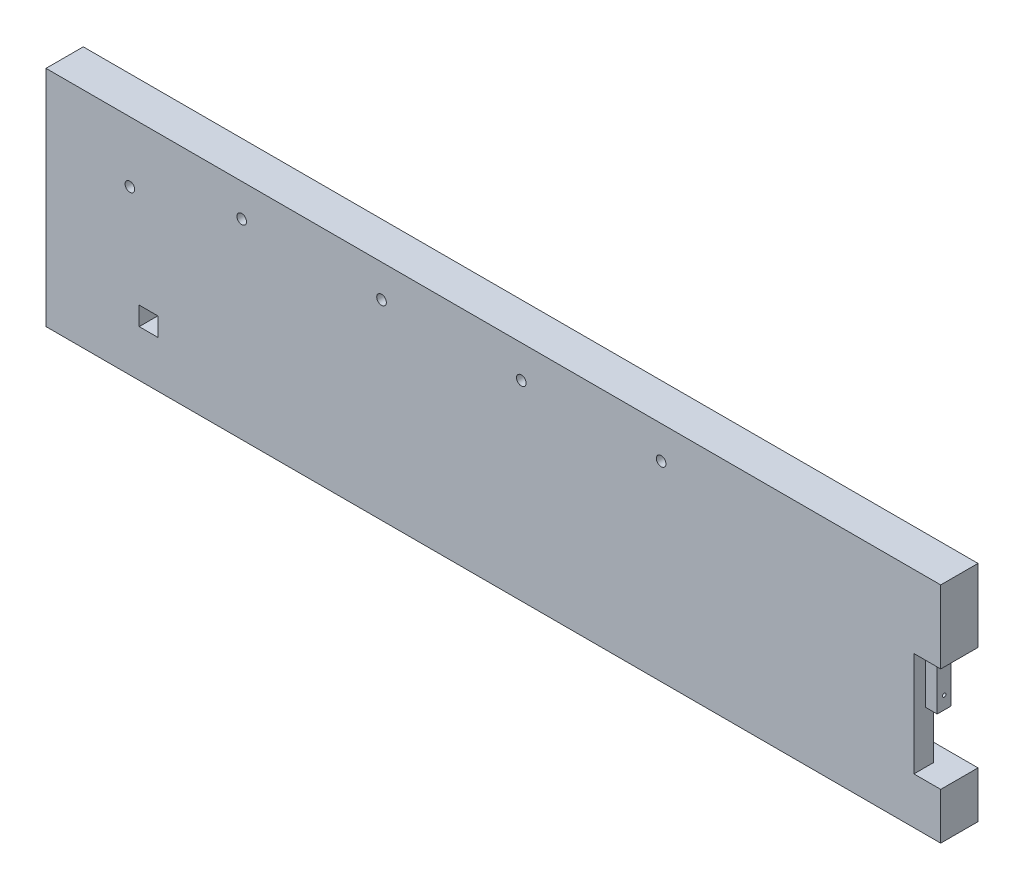
from build123d import *

# Parameters (mm, degrees)
SKETCH1_W           = 2438.4
SKETCH1_H           = 609.6
SKETCH1_R           = 13.119830451
SKETCH1_W_2         = 50.8
SKETCH1_H_2         = 50.8
BOSS_EXTRUDE1_DEPTH = 101.6
SKETCH2_W           = 127
SKETCH2_H           = 63.5
CUT_EXTRUDE1_DEPTH  = 50.8
SKETCH3_R           = 4.7625
CUT_EXTRUDE2_DEPTH  = 152.4
SKETCH4_W           = 73.025
SKETCH4_H           = 284.1625
CUT_EXTRUDE3_DEPTH  = 1261.822842433
SKETCH5_W           = 38.1
SKETCH5_H           = 123.825
SKETCH5_R           = 4.7625
BOSS_EXTRUDE2_DEPTH = 31.75
CUT_EXTRUDE4_DEPTH  = 431.8


with BuildPart() as part:
    # Sketch1 → Boss-Extrude1 (new body)
    with BuildSketch(Plane.XY):
        Rectangle(SKETCH1_W, SKETCH1_H)
        with Locations((-990.6, 139.7)):
            Circle(SKETCH1_R, mode=Mode.SUBTRACT)
        with Locations((-685.8, 215.9)):
            Circle(SKETCH1_R, mode=Mode.SUBTRACT)
        with Locations((-304.8, 215.9)):
            Circle(SKETCH1_R, mode=Mode.SUBTRACT)
        with Locations((76.2, 215.9)):
            Circle(SKETCH1_R, mode=Mode.SUBTRACT)
        with Locations((457.2, 215.9)):
            Circle(SKETCH1_R, mode=Mode.SUBTRACT)
        with Locations((-939.8, -152.4)):
            Rectangle(SKETCH1_W_2, SKETCH1_H_2, mode=Mode.SUBTRACT)
    extrude(amount=BOSS_EXTRUDE1_DEPTH)

    # Sketch2 → Cut-Extrude1 (cut)
    with BuildSketch(Plane(origin=(0, 0, 0), x_dir=(-1, 0, 0), z_dir=(0, 0, -1))):
        with Locations((-774.7, -241.3)):
            Rectangle(SKETCH2_W, SKETCH2_H)
        with Locations((774.7, -241.3)):
            Rectangle(SKETCH2_W, SKETCH2_H)
        with Locations((774.7, 241.3)):
            Rectangle(SKETCH2_W, SKETCH2_H)
        with Locations((-774.7, 241.3)):
            Rectangle(SKETCH2_W, SKETCH2_H)
    extrude(amount=-CUT_EXTRUDE1_DEPTH, mode=Mode.SUBTRACT)

    # Sketch3 → Cut-Extrude2 (cut)
    with BuildSketch(Plane.XZ.offset(304.8)):
        with Locations((-742.95, 25.4)):
            Circle(SKETCH3_R)
        with Locations((-806.45, 25.4)):
            Circle(SKETCH3_R)
        with Locations((742.95, 25.4)):
            Circle(SKETCH3_R)
        with Locations((806.45, 25.4)):
            Circle(SKETCH3_R)
    extrude(amount=-CUT_EXTRUDE2_DEPTH, mode=Mode.SUBTRACT)

    # Sketch4 → Cut-Extrude3 (cut, through all)
    with BuildSketch(Plane.XY.offset(101.6)):
        with Locations((1182.6875, -35.71875)):
            Rectangle(SKETCH4_W, SKETCH4_H)
    extrude(amount=-CUT_EXTRUDE3_DEPTH, mode=Mode.SUBTRACT)

    # Sketch5 → Boss-Extrude2 (add)
    with BuildSketch(Plane(origin=(1146.175, 0, 0), x_dir=(0, 0, -1), z_dir=(1, 0, 0))):
        with Locations((-50.8, 25.4)):
            Rectangle(SKETCH5_W, SKETCH5_H)
        with Locations((-50.8, -1.5875)):
            Circle(SKETCH5_R, mode=Mode.SUBTRACT)
        with BuildLine():
            Line((-46.0375, 76.2), (-46.0375, 71.4375))
            ThreePointArc((-46.0375, 71.4375), (-50.8, 66.675), (-55.5625, 71.4375))
            Line((-55.5625, 71.4375), (-55.5625, 76.2))
            ThreePointArc((-55.5625, 76.2), (-50.8, 80.9625), (-46.0375, 76.2))
        make_face(mode=Mode.SUBTRACT)
    extrude(amount=BOSS_EXTRUDE2_DEPTH)

    # Sketch8 → Cut-Extrude4 (cut)
    with BuildSketch(Plane(origin=(1146.175, 0, 0), x_dir=(0, 0, -1), z_dir=(1, 0, 0))):
        Polygon((-47.625, -177.8), (0, -177.8), (0, -17.4625), (-6.35, -17.4625), (-6.35, -36.5125), (-47.625, -36.5125), align=None)
    extrude(amount=-CUT_EXTRUDE4_DEPTH, mode=Mode.SUBTRACT)


solid = part.part
